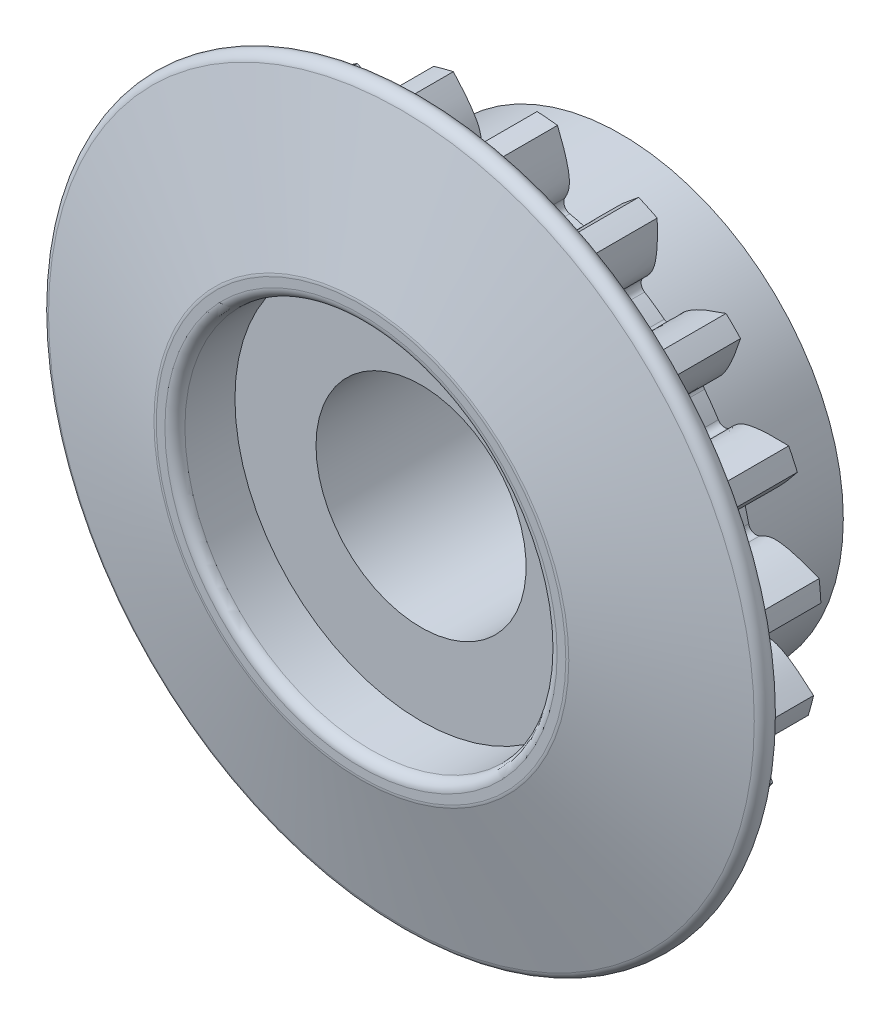
from build123d import *

# Parameters (mm, degrees)
ESQUISSE1_R                        = 5.8125
BASE_EXTRUSION_DEPTH               = 2.5
BOSS_EXTRU_1_DEPTH                 = 2.5
CONG_1_R                           = 0.1875
R_P_TITION_CIRCULAIRE1_COUNT       = 18
CONG_1_OF_R_P_TITION_CIRCULAIRE1_R = 0.1875
ESQUISSE3_R                        = 2.625
ENL_V_MAT_EXTRU_2_DEPTH            = 11.882660604
BOSS_EXTRU_2_START                 = 2.5
ESQUISSE5_R                        = 5.55
ESQUISSE5_R_2                      = 2.625
BOSS_EXTRU_2_DEPTH                 = 2.5


# Read off the part's stored shape, not the designer's step: Boss.-Extru.1
with BuildPart() as part:
    # Esquisse1 → Base-Extrusion (new body)
    with BuildSketch(Plane.XY):
        Circle(ESQUISSE1_R)
    extrude(amount=BASE_EXTRUSION_DEPTH)

    # Boss.-Extru.1 outline → Boss.-Extru.1 (add)
    with BuildSketch(Plane.XY):
        with BuildLine():
            ThreePointArc((5.7371516, 0.932870714), (5.790415339, 0.50620791), (5.811992932, 0.076775049))
            add(Edge.make_bspline(
                [(5.811992932, 0.076775049), (5.852864478, 0.053944406), (6.018916692, -0.032688836), (6.342485398, -0.138644811), (6.895308513, 0.033217344), (7.251636667, 0.252036167), (7.489428947, 0.398062875)],
                knots=[0.133370406, 0.133370406, 0.133370406, 0.133370406, 0.200242702, 0.399878649, 0.599514596, 1, 1, 1, 1], degree=3))
            ThreePointArc((7.489428947, 0.398062875), (7.471503664, 0.653171496), (7.444891283, 0.907520677))
            add(Edge.make_bspline(
                [(7.444891283, 0.907520677), (7.18536796, 1.010071213), (6.796476165, 1.163741647), (6.222217868, 1.237072437), (5.921942623, 1.076578968), (5.773441647, 0.962446954), (5.7371516, 0.932870714)],
                knots=[0, 0, 0, 0, 0.400485404, 0.600121351, 0.799757298, 0.866629594, 0.866629594, 0.866629594, 0.866629594], degree=3))
        make_face()
    boss_extru_1 = extrude(amount=BOSS_EXTRU_1_DEPTH)

    # Congé1
    cong_1_edges = [part.edges().sort_by_distance(p)[0] for p in [
        (5.811992932, 0.076775049, 1.25),
        (5.7371516, 0.932870714, 1.25),
    ]]
    fillet(cong_1_edges, radius=CONG_1_R)

    # Répétition circulaire1: Boss.-Extru.1 ×18 about axis
    r_p_tition_circulaire1_axis = Axis((0, 0, -50), (0, 0, 1))
    for i in range(1, R_P_TITION_CIRCULAIRE1_COUNT):
        add(boss_extru_1.rotate(r_p_tition_circulaire1_axis, i * 360 / R_P_TITION_CIRCULAIRE1_COUNT))

    # Congé1 of Répétition circulaire1
    cong_1_of_r_p_tition_circulaire1_edges = [part.edges().sort_by_distance(p)[0] for p in [
        (5.435228257, 2.059963603, 1.25),
        (5.072098448, 2.838833139, 1.25),
        (4.402894839, 3.794690144, 1.25),
        (3.795275366, 4.40239039, 1.25),
        (2.839507323, 5.07172105, 1.25),
        (2.060686063, 5.434954388, 1.25),
        (0.933633318, 5.737027547, 1.25),
        (0.077547609, 5.811982675, 1.25),
        (-1.084850645, 5.710363853, 1.25),
        (-1.914944232, 5.488000076, 1.25),
        (-2.972485609, 4.994946001, 1.25),
        (-3.676465537, 4.502083674, 1.25),
        (-4.501594939, 3.677063945, 1.25),
        (-4.994550839, 2.973149537, 1.25),
        (-5.487745484, 1.915673709, 1.25),
        (-5.710219598, 1.085609686, 1.25),
        (-5.811992932, -0.076775049, 1.25),
        (-5.7371516, -0.932870714, 1.25),
        (-5.435228257, -2.059963603, 1.25),
        (-5.072098448, -2.838833139, 1.25),
        (-4.402894839, -3.794690144, 1.25),
        (-3.795275366, -4.40239039, 1.25),
        (-2.839507323, -5.07172105, 1.25),
        (-2.060686063, -5.434954388, 1.25),
        (-0.933633318, -5.737027547, 1.25),
        (-0.077547609, -5.811982675, 1.25),
        (1.084850645, -5.710363853, 1.25),
        (1.914944232, -5.488000076, 1.25),
        (2.972485609, -4.994946001, 1.25),
        (3.676465537, -4.502083674, 1.25),
        (4.501594939, -3.677063945, 1.25),
        (4.994550839, -2.973149537, 1.25),
        (5.487745484, -1.915673709, 1.25),
        (5.710219598, -1.085609686, 1.25),
    ]]
    fillet(cong_1_of_r_p_tition_circulaire1_edges, radius=CONG_1_OF_R_P_TITION_CIRCULAIRE1_R)

    # Esquisse3 → Enlèv. mat.-Extru.2 (cut, through all)
    with BuildSketch(Plane.XY):
        with Locations(Location((0, 0, 0), (0, 0, 180))):
            Circle(ESQUISSE3_R)
    extrude(amount=ENL_V_MAT_EXTRU_2_DEPTH, mode=Mode.SUBTRACT)

    # Esquisse5 → Boss.-Extru.2 (add)
    with BuildSketch(Plane(origin=(0, 0, 0), x_dir=(-1, 0, 0), z_dir=(0, 0, -1)).offset(BOSS_EXTRU_2_START)):
        with Locations(Location((0, 0, 0), (0, 0, 180))):
            Circle(ESQUISSE5_R)
        Circle(ESQUISSE5_R_2, mode=Mode.SUBTRACT)
    extrude(amount=-BOSS_EXTRU_2_DEPTH)

    # Esquisse6 → Révolution1 (revolve)
    with BuildSketch(Plane(origin=(0, 0, 0), x_dir=(1, 0, 0), z_dir=(0, 1, 0)), mode=Mode.PRIVATE) as r_volution1_sk:
        with BuildLine():
            Line((-4.65, -2.5), (-8.75, -2.5))
            ThreePointArc((-8.75, -2.5), (-8.997749686, -2.71653221), (-8.816333075, -2.991039256))
            Line((-8.816333075, -2.991039256), (-5.182561297, -3.991039256))
            ThreePointArc((-5.182561297, -3.991039256), (-5.149696012, -3.997749686), (-5.116228222, -4))
            Line((-5.116228222, -4), (-4.9, -4))
            ThreePointArc((-4.9, -4), (-4.723223305, -3.926776695), (-4.65, -3.75))
            Line((-4.65, -3.75), (-4.65, -2.5))
        make_face()
    revolve(r_volution1_sk.sketch.rotate(Axis((0, 0, 4.806133888), (0, 0, -1)), 180), axis=Axis((0, 0, 4.806133888), (0, 0, -1)))


solid = part.part
